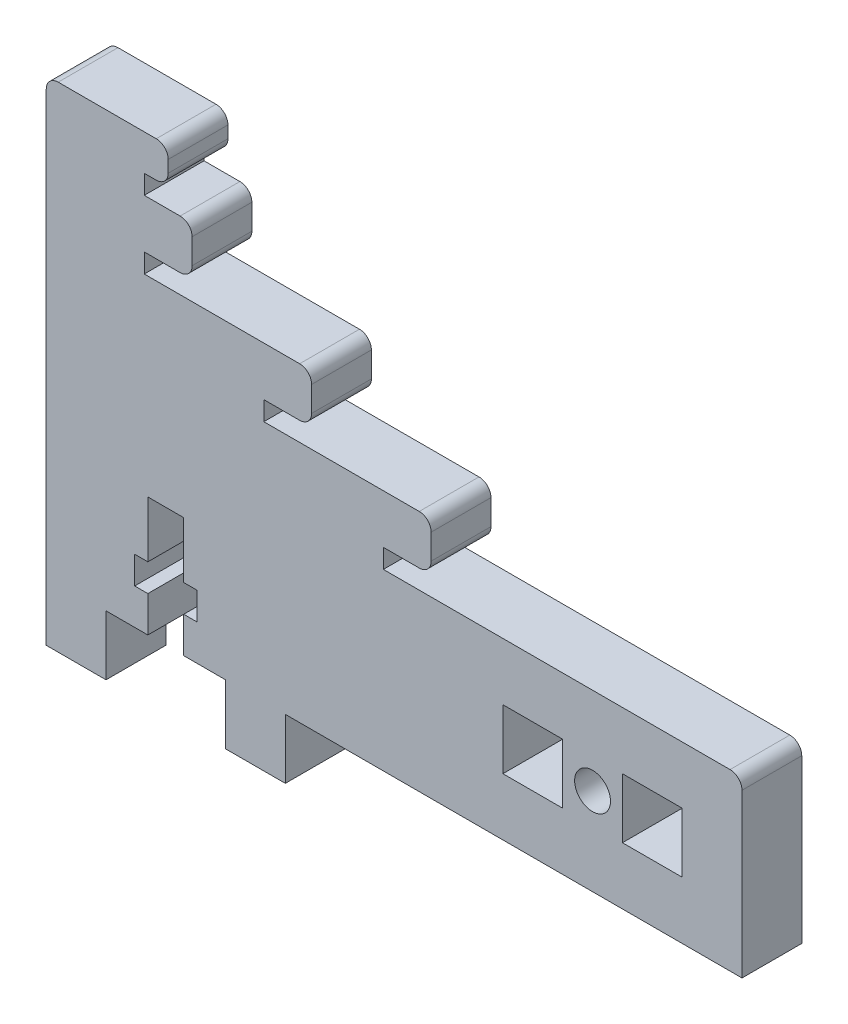
from build123d import *

# Parameters (mm, degrees)
SKETCH1_R           = 1.5
SKETCH1_W           = 5
SKETCH1_H           = 5
BOSS_EXTRUDE1_DEPTH = 5
FILLET3_R           = 1


with BuildPart() as part:
    # Sketch1 → Boss-Extrude1 (new body)
    with BuildSketch(Plane.XY):
        Polygon((0, 5), (0, 19.982808697), (0, 25.3), (0, 30.1), (0, 41.3), (10.2, 41.3), (10.2, 38.3), (8.2, 38.3), (8.2, 36.7), (12.2, 36.7), (12.2, 32.6), (8.2, 32.6), (8.2, 31), (22.2, 31), (22.2, 26.9), (18.2, 26.9), (18.2, 25.3), (32.2, 25.3), (32.2, 21.2), (28.2, 21.2), (28.2, 19.6), (58.2, 19.6), (58.2, 5), (20, 5), (20, 0), (15, 0), (15, 5), (11.5, 5), (11.5, 8), (12.6, 8), (12.6, 10.3), (11.5, 10.3), (11.5, 15), (8.5, 15), (8.5, 10.3), (7.4, 10.3), (7.4, 8), (8.5, 8), (8.5, 5), (5, 5), (5, 0), (0, 0), align=None)
        with Locations((45.7, 12.3)):
            Circle(SKETCH1_R, mode=Mode.SUBTRACT)
        with Locations((40.7, 12.3)):
            Rectangle(SKETCH1_W, SKETCH1_H, mode=Mode.SUBTRACT)
        with Locations((50.7, 12.3)):
            Rectangle(SKETCH1_W, SKETCH1_H, mode=Mode.SUBTRACT)
    extrude(amount=BOSS_EXTRUDE1_DEPTH)

    # Fillet3
    fillet3_edges = [part.edges().sort_by_distance(p)[0] for p in [
        (32.2, 21.2, 2.5),
        (58.2, 19.6, 2.5),
        (0, 41.3, 2.5),
        (10.2, 38.3, 2.5),
        (10.2, 41.3, 2.5),
        (12.2, 32.6, 2.5),
        (12.2, 36.7, 2.5),
        (22.2, 26.9, 2.5),
        (22.2, 31, 2.5),
        (32.2, 25.3, 2.5),
    ]]
    fillet(fillet3_edges, radius=FILLET3_R)


solid = part.part
